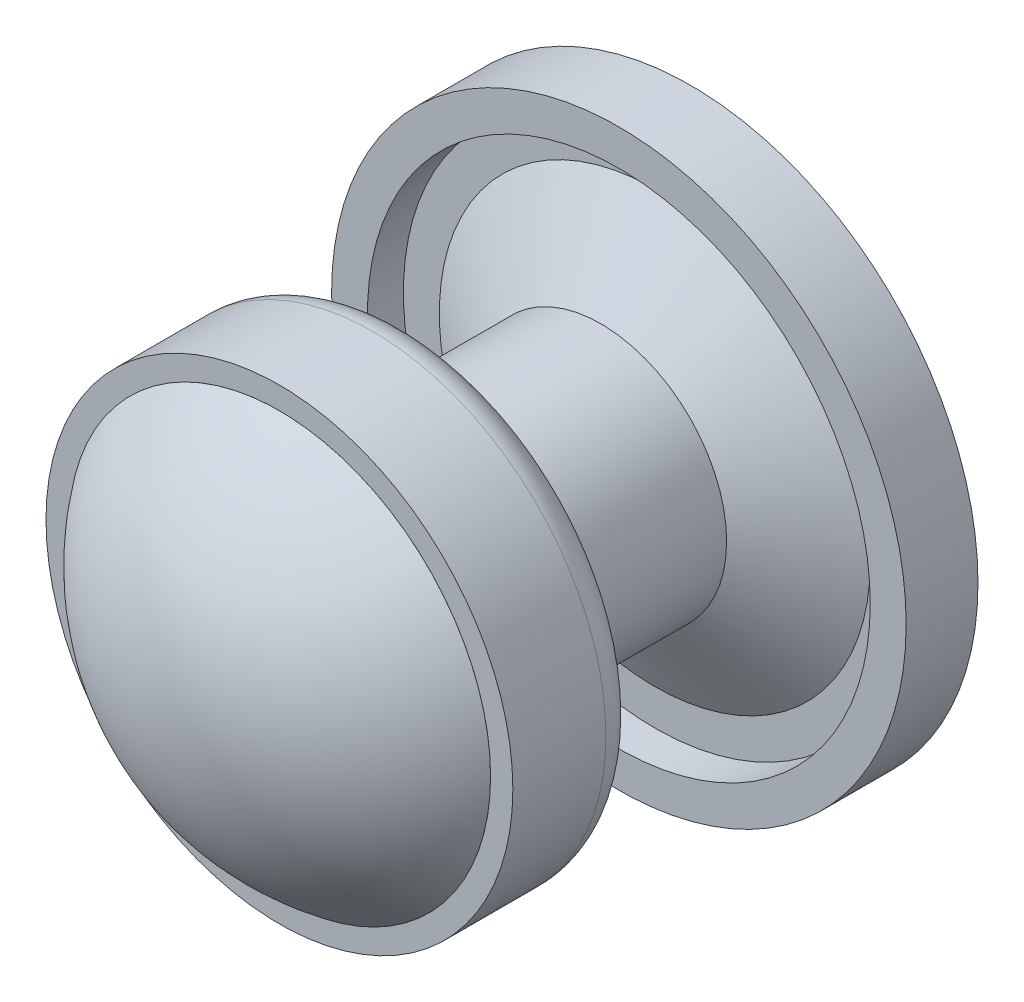
from build123d import *

# Parameters (mm, degrees)
CROQUIS2_R              = 8
SALIENTE_EXTRUIR1_DEPTH = 2
CROQUIS3_R              = 7
CORTAR_EXTRUIR1_DEPTH   = 1
CROQUIS4_R              = 6
CROQUIS5_R              = 3.5
CROQUIS6_R              = 3.5
SALIENTE_EXTRUIR2_DEPTH = 4
CROQUIS9_R              = 3.5
CROQUIS10_R             = 5.916
CROQUIS11_R             = 6.5
SALIENTE_EXTRUIR3_DEPTH = 3.5
REDONDEO2_R             = 1
CROQUIS15_R             = 5.88
SALIENTE_EXTRUIR4_DEPTH = 0.001
C_PULA1_FACE_RADIUS     = 5.88
C_PULA1_HEIGHT          = 3
CROQUIS16_R             = 1.4
CORTAR_EXTRUIR2_DEPTH   = 6


with BuildPart() as part:
    # Croquis2 → Saliente-Extruir1 (new body)
    with BuildSketch(Plane.XY):
        Circle(CROQUIS2_R)
    extrude(amount=SALIENTE_EXTRUIR1_DEPTH)

    # Croquis3 → Cortar-Extruir1 (cut)
    with BuildSketch(Plane.XY.offset(2)):
        Circle(CROQUIS3_R)
    extrude(amount=-CORTAR_EXTRUIR1_DEPTH, mode=Mode.SUBTRACT)

    # Croquis4 → Recubrir1 section 0
    with BuildSketch(Plane.XY.offset(1)):
        Circle(CROQUIS4_R)
    # Croquis5 → Recubrir1 section 1
    with BuildSketch(Plane.XY.offset(2.5)):
        Circle(CROQUIS5_R)
    loft()

    # Croquis6 → Saliente-Extruir2 (add)
    with BuildSketch(Plane.XY.offset(2.5)):
        Circle(CROQUIS6_R)
    extrude(amount=SALIENTE_EXTRUIR2_DEPTH)

    # Croquis9 → Recubrir3 section 0
    with BuildSketch(Plane.XY.offset(6.5)):
        Circle(CROQUIS9_R)
    # Croquis10 → Recubrir3 section 1
    with BuildSketch(Plane.XY.offset(7.952)):
        Circle(CROQUIS10_R)
    loft()

    # Croquis11 → Saliente-Extruir3 (add)
    with BuildSketch(Plane.XY.offset(7.952)):
        Circle(CROQUIS11_R)
    extrude(amount=SALIENTE_EXTRUIR3_DEPTH)

    # Redondeo2
    # the kernel refuses this fillet: 1 mm, written as the material it takes off along each edge
    with BuildSketch(Plane(origin=(0, 0, 7.952), x_dir=(1, 0, 0), z_dir=(0, -1, 0))) as redondeo2_piece_1:
        with BuildLine():
            CenterArc((5.5, 0.909364613), REDONDEO2_R, 294.582307044, 65.417692956)
            Line((5.916, 0), (5.92432, -0.018187292))
            ThreePointArc((5.92432, -0.018187292), (6.208, -0.02), (6.5, -0.02))
            Line((6.5, -0.02), (6.52, 0))
            Line((6.52, 0), (6.52, 0.909364613))
            Line((6.52, 0.909364613), (6.5, 0.909364613))
        make_face()
    revolve(axis=Axis((0, 0, 7.952), (0, 0, 1)), mode=Mode.SUBTRACT)

    # Croquis15 → Saliente-Extruir4 (add)
    with BuildSketch(Plane.XY.offset(11.452)):
        Circle(CROQUIS15_R)
    extrude(amount=SALIENTE_EXTRUIR4_DEPTH)

    # Cúpula1: a dome of height H over a round flat face of radius A is a cap of a sphere of radius (A * A + H * H) / (2 * H)
    c_pula1_r = (C_PULA1_FACE_RADIUS * C_PULA1_FACE_RADIUS + C_PULA1_HEIGHT * C_PULA1_HEIGHT) / (2 * C_PULA1_HEIGHT)
    c_pula1_base = Plane((0, 0, 11.453), z_dir=(0, 0, 1))
    with Locations(c_pula1_base.offset(C_PULA1_HEIGHT - c_pula1_r)):
        c_pula1_ball = Sphere(c_pula1_r, mode=Mode.PRIVATE)
    add(split(c_pula1_ball, bisect_by=c_pula1_base, keep=Keep.TOP, mode=Mode.PRIVATE))

    # Croquis16 → Cortar-Extruir2 (cut)
    with BuildSketch(Plane(origin=(0, 0, 0), x_dir=(-1, 0, 0), z_dir=(0, 0, -1))):
        Circle(CROQUIS16_R)
    extrude(amount=-CORTAR_EXTRUIR2_DEPTH, mode=Mode.SUBTRACT)


solid = part.part
